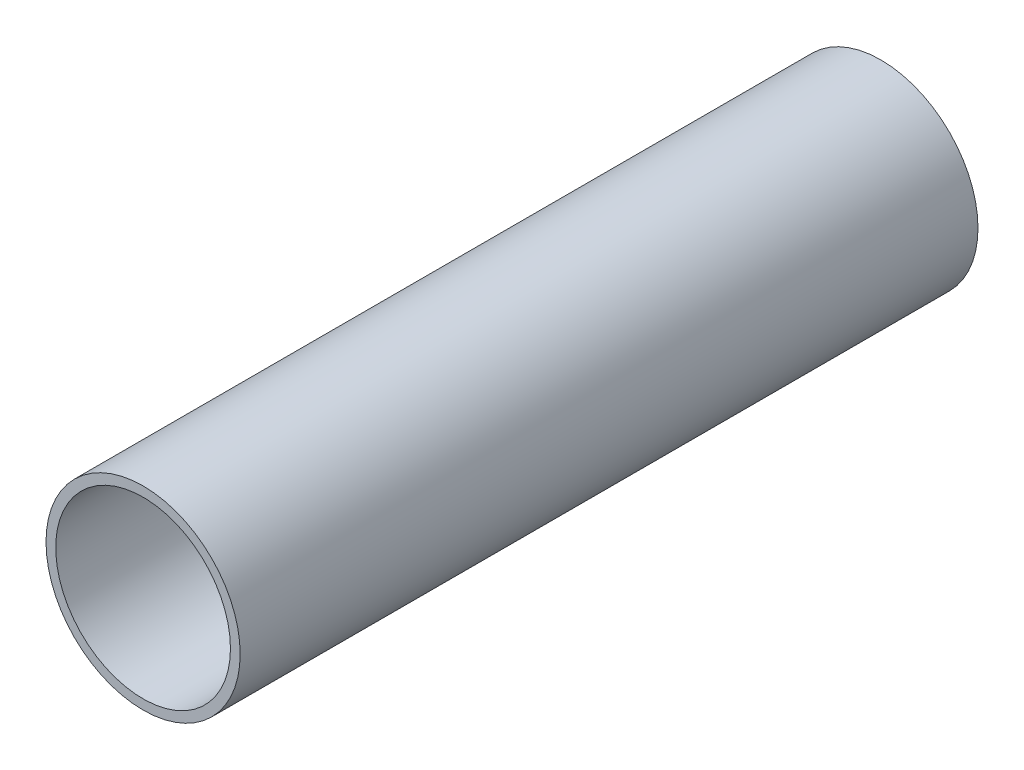
from build123d import *

# Parameters (mm, degrees)
SKETCH1_R           = 2.5
BOSS_EXTRUDE1_DEPTH = 19
CUT_EXTRUDE1_REACH  = 44.113
SKETCH3_R           = 1.6
SKETCH3_3_R         = 2.25
SKETCH3_3_R_2       = 1.6
CUT_EXTRUDE2_DEPTH  = 6


with BuildPart() as part:
    # Sketch1 → Boss-Extrude1 (new body)
    with BuildSketch(Plane.XY):
        with Locations((35, 0)):
            Circle(SKETCH1_R)
    extrude(amount=BOSS_EXTRUDE1_DEPTH)

    # Sketch3 → Cut-Extrude1 (cut, up to next)
    with BuildSketch(Plane.XY.offset(19), mode=Mode.PRIVATE) as cut_extrude1_sk1:
        with Locations((35, 0)):
            Circle(SKETCH3_R)
    cut_extrude1_tool1 = extrude(cut_extrude1_sk1.sketch, amount=-CUT_EXTRUDE1_REACH, mode=Mode.PRIVATE) & part.part
    add(cut_extrude1_tool1.solids().sort_by_distance((35, 0, 19))[0], mode=Mode.SUBTRACT)

    # Sketch3<3> → Cut-Extrude2 (cut)
    with BuildSketch(Plane.XY.offset(19)):
        with Locations((35, 0)):
            Circle(SKETCH3_3_R)
        with Locations((35, 0)):
            Circle(SKETCH3_3_R_2, mode=Mode.SUBTRACT)
    cut_extrude2 = extrude(amount=-CUT_EXTRUDE2_DEPTH, mode=Mode.SUBTRACT)

    # Mirror1: Cut-Extrude2 across plane
    add(cut_extrude2.mirror(Plane.XY.offset(9.5)), mode=Mode.SUBTRACT)


solid = part.part
